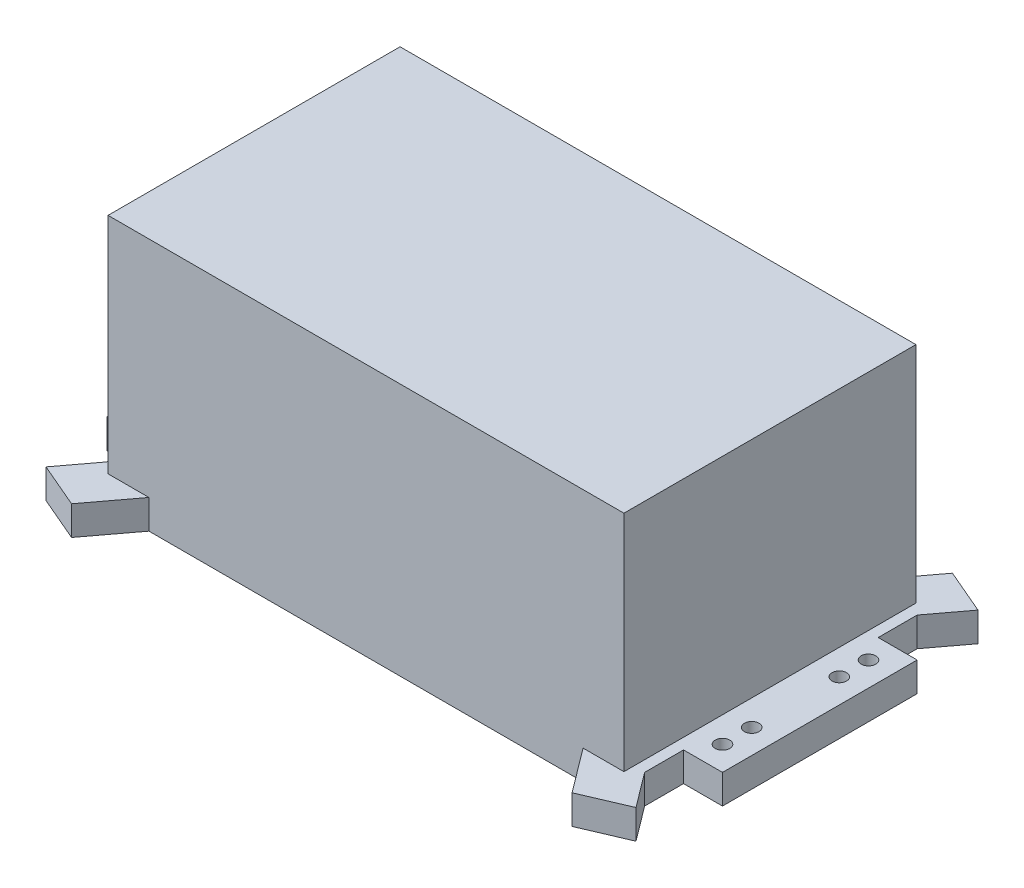
from build123d import *

# Parameters (mm, degrees)
SKETCH_1_R          = 1.5
EXTRUDE_1_DEPTH     = 6
SKETCH_2_W          = 106
SKETCH_2_H          = 60
EXTRUDE_2_DEPTH     = 46
SKETCH_3_R          = 2.913601035
SKETCH_3_W          = 27.829913336
SKETCH_3_H          = 14.266598172
SKETCH_3_W_2        = 28.231789341
SKETCH_3_W_3        = 5.927671071
SKETCH_3_H_2        = 3.014070036
SKETCH_3_W_4        = 6.731423082
SKETCH_3_H_3        = 3.918291047
CUT_EXTRUDE_1_DEPTH = 2


with BuildPart() as part:
    # 草图1 → 凸台-拉伸1 (new body)
    with BuildSketch(Plane(origin=(0, 0, 0), x_dir=(1, 0, 0), z_dir=(0, 1, 0))):
        Polygon((44.601753779, -30), (-44.601753779, -30), (-51.423054046, -39.075905643), (-60.615391847, -35.138784137), (-55.25, -28), (-55.25, -20), (-63.25, -20), (-63.25, 20), (-55.25, 20), (-55.25, 28), (-60.615391847, 35.138784137), (-51.423054046, 39.075905643), (-44.601753779, 30), (44.601753779, 30), (51.423054046, 39.075905643), (60.615391847, 35.138784137), (55.25, 28), (55.25, 20), (63.25, 20), (63.25, -20), (55.25, -20), (55.25, -28), (60.615391847, -35.138784137), (51.423054046, -39.075905643), align=None)
        with Locations((58.25, 15)):
            Circle(SKETCH_1_R, mode=Mode.SUBTRACT)
        with Locations((-58.25, 15)):
            Circle(SKETCH_1_R, mode=Mode.SUBTRACT)
        with Locations((58.25, 9)):
            Circle(SKETCH_1_R, mode=Mode.SUBTRACT)
        with Locations((-58.25, 9)):
            Circle(SKETCH_1_R, mode=Mode.SUBTRACT)
        with Locations((58.25, -9)):
            Circle(SKETCH_1_R, mode=Mode.SUBTRACT)
        with Locations((58.25, -15)):
            Circle(SKETCH_1_R, mode=Mode.SUBTRACT)
        with Locations((-58.25, -9)):
            Circle(SKETCH_1_R, mode=Mode.SUBTRACT)
        with Locations((-58.25, -15)):
            Circle(SKETCH_1_R, mode=Mode.SUBTRACT)
    extrude(amount=EXTRUDE_1_DEPTH)

    # 草图2 → 凸台-拉伸2 (add)
    with BuildSketch(Plane(origin=(0, 6, 0), x_dir=(1, 0, 0), z_dir=(0, 1, 0))):
        Rectangle(SKETCH_2_W, SKETCH_2_H)
    extrude(amount=EXTRUDE_2_DEPTH)

    # 草图3 → 切除-拉伸1 (cut)
    with BuildSketch(Plane(origin=(0, 0, -30), x_dir=(-1, 0, 0), z_dir=(0, 0, -1))):
        with Locations((7.233768087, 14.983525058)):
            Circle(SKETCH_3_R)
        with Locations((-28.282023842, 32.56560027)):
            Rectangle(SKETCH_3_W, SKETCH_3_H)
        with Locations((1.858676522, 32.56560027)):
            Rectangle(SKETCH_3_W_2, SKETCH_3_H)
        with Locations((-33.305473902, 14.481180052)):
            Rectangle(SKETCH_3_W_3, SKETCH_3_H_2)
        with Locations((-22.856697776, 14.029069547)):
            Rectangle(SKETCH_3_W_4, SKETCH_3_H_3)
        with Locations((-11.001355633, 14.029069547)):
            Rectangle(SKETCH_3_W_4, SKETCH_3_H_3)
    extrude(amount=-CUT_EXTRUDE_1_DEPTH, mode=Mode.SUBTRACT)


solid = part.part
